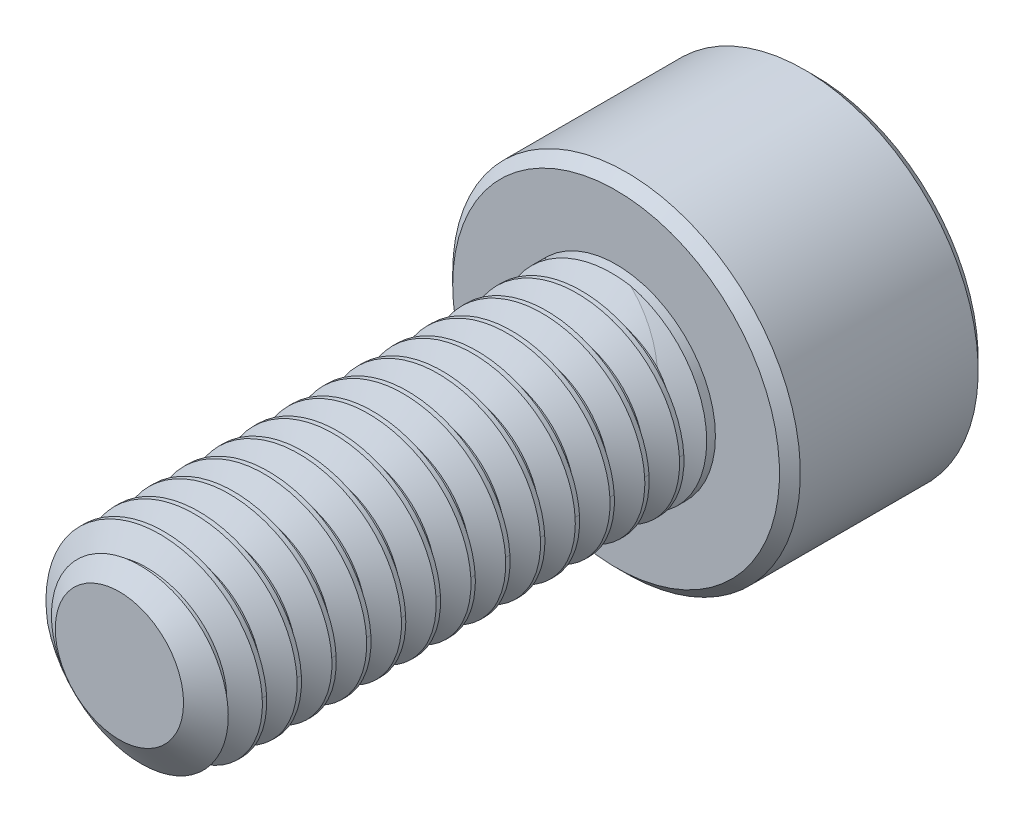
from build123d import *

# Parameters (mm, degrees)
SKETCH1_R          = 2
EXTRUDE1_DEPTH     = 10
CUT_SWEEP1_PITCH   = 0.7
SKETCH6_R          = 3.5
EXTRUDE2_DEPTH     = 4
CUT_EXTRUDE1_DEPTH = 2.25
CHAMFER1_SIZE      = 0.21


with BuildPart() as part:
    # Sketch1 → Extrude1 (new body)
    with BuildSketch(Plane.XY):
        Circle(SKETCH1_R)
    extrude(amount=-EXTRUDE1_DEPTH)

    # Cut-Sweep1: the profile of Sketch3 profile screwed along a right-hand helix of 15.285714 turns, 6 arcs to a turn; built about Z, then put on its axis
    cut_sweep1_z = Axis((0, 0, 0), (0, 0, 1))
    cut_sweep1_corners = [(2.0003, 0, -0.612673205), (1.545336663, 0, -0.35), (1.545336663, 0, -0.2625), (2.0003, 0, 0.000173205)]
    with BuildLine(mode=Mode.PRIVATE) as cut_sweep1_profile:
        Line(cut_sweep1_corners[0], cut_sweep1_corners[1])
        Line(cut_sweep1_corners[1], cut_sweep1_corners[2])
        Line(cut_sweep1_corners[2], cut_sweep1_corners[3])
        Line(cut_sweep1_corners[3], cut_sweep1_corners[0])
    cut_sweep1_cap = Face(cut_sweep1_profile.wire())
    cut_sweep1_turn_angles = [0, 30, 60, 90, 120, 150, 180, 210, 240, 270, 300, 330, 360]
    cut_sweep1_turn_weights = [1, 0.8660254037844387, 1, 0.8660254037844387, 1, 0.8660254037844387, 1, 0.8660254037844387, 1, 0.8660254037844387, 1, 0.8660254037844387, 1]
    cut_sweep1_turn_rails = [Edge.make_bspline([Vector(p[0], p[1], 0).rotate(cut_sweep1_z, cut_sweep1_turn_angles[k]) / cut_sweep1_turn_weights[k] + Vector(0, 0, p[2] + CUT_SWEEP1_PITCH * cut_sweep1_turn_angles[k] / 360) for k in range(13)], [0, 0, 0, 1, 1, 2, 2, 3, 3, 4, 4, 5, 5, 6, 6, 6], 2, cut_sweep1_turn_weights) for p in cut_sweep1_corners]
    cut_sweep1_turn_sides = [Face.make_surface_from_curves(cut_sweep1_turn_rails[p[0]], cut_sweep1_turn_rails[p[1]]) for p in [(0, 1), (1, 2), (2, 3), (3, 0)]]
    cut_sweep1_last_angles = [5400, 5430, 5460, 5481.428571429, 5502.857142857]
    cut_sweep1_last_weights = [1, 0.8660254037844387, 1, 0.9308737486442353, 1]
    cut_sweep1_last_rails = [Edge.make_bspline([Vector(p[0], p[1], 0).rotate(cut_sweep1_z, cut_sweep1_last_angles[k]) / cut_sweep1_last_weights[k] + Vector(0, 0, p[2] + CUT_SWEEP1_PITCH * cut_sweep1_last_angles[k] / 360) for k in range(5)], [0, 0, 0, 1, 1, 2, 2, 2], 2, cut_sweep1_last_weights) for p in cut_sweep1_corners]
    cut_sweep1_last_sides = [Face.make_surface_from_curves(cut_sweep1_last_rails[p[0]], cut_sweep1_last_rails[p[1]]) for p in [(0, 1), (1, 2), (2, 3), (3, 0)]]
    cut_sweep1 = Plane(origin=(0, 0, 0), x_dir=(0, 1, 0), z_dir=(0, 0, -1)) * Solid(Shell([*[p.moved(Location((0, 0, CUT_SWEEP1_PITCH * i))) for i in range(15) for p in cut_sweep1_turn_sides], *cut_sweep1_last_sides, cut_sweep1_cap, cut_sweep1_cap.rotate(cut_sweep1_z, 5502.857142857).moved(Location((0, 0, CUT_SWEEP1_PITCH * 5502.857142857 / 360)))]))
    add(cut_sweep1, mode=Mode.SUBTRACT)

    # Sketch4 → Cut-Revolve1 (revolve, cut)
    with BuildSketch(Plane(origin=(0, 0, 0), x_dir=(0, 0, -1), z_dir=(1, 0, 0)), mode=Mode.PRIVATE) as cut_revolve1_sk:
        Polygon((0.496211411, 2), (0, 1.291336663), (0, 2), align=None)
    revolve(cut_revolve1_sk.sketch.rotate(Axis((0, 0, 0), (0, 0, -1)), 271.401126896), axis=Axis((0, 0, 0), (0, 0, -1)), mode=Mode.SUBTRACT)

    # Sketch6 → Extrude2 (add)
    with BuildSketch(Plane(origin=(0, 0, -10), x_dir=(-1, 0, 0), z_dir=(0, 0, -1))):
        Circle(SKETCH6_R)
    extrude(amount=EXTRUDE2_DEPTH)

    # Sketch7 → Cut-Extrude1 (cut)
    with BuildSketch(Plane(origin=(0, 0, -14), x_dir=(-1, 0, 0), z_dir=(0, 0, -1))):
        Polygon((0, 1.732050808), (-1.5, 0.866025404), (-1.5, -0.866025404), (0, -1.732050808), (1.5, -0.866025404), (1.5, 0.866025404), align=None)
    extrude(amount=-CUT_EXTRUDE1_DEPTH, mode=Mode.SUBTRACT)

    # Cut-Extrude2 cone 1 section (through the dimple's axis) → Cut-Extrude2 (revolve, cut)
    with BuildSketch(Plane(origin=(0, 0, -14), x_dir=(0, 1, 0), z_dir=(1, 0, 0))):
        Polygon((0, 0), (1.732050808, 0), (0, 1.732050808), align=None)
    revolve(axis=Axis((0, 0, -14), (0, 0, 1)), mode=Mode.SUBTRACT)

    # Chamfer1
    chamfer1_edges = [part.edges().sort_by_distance(p)[0] for p in [
        (3.5, 0, -10),
        (3.5, 0, -14),
    ]]
    chamfer(chamfer1_edges, length=CHAMFER1_SIZE)

    # Sketch10 → Revolve1 (revolve)
    with BuildSketch(Plane(origin=(0, 0, 0), x_dir=(0, 0, -1), z_dir=(1, 0, 0)), mode=Mode.PRIVATE) as revolve1_sk:
        Polygon((10, 2), (10, 0), (8.996572875, 0), (9.825, 2), align=None)
    revolve(revolve1_sk.sketch.rotate(Axis((0, 0, -10), (0, 0, 1)), 270), axis=Axis((0, 0, -10), (0, 0, 1)))


solid = part.part
